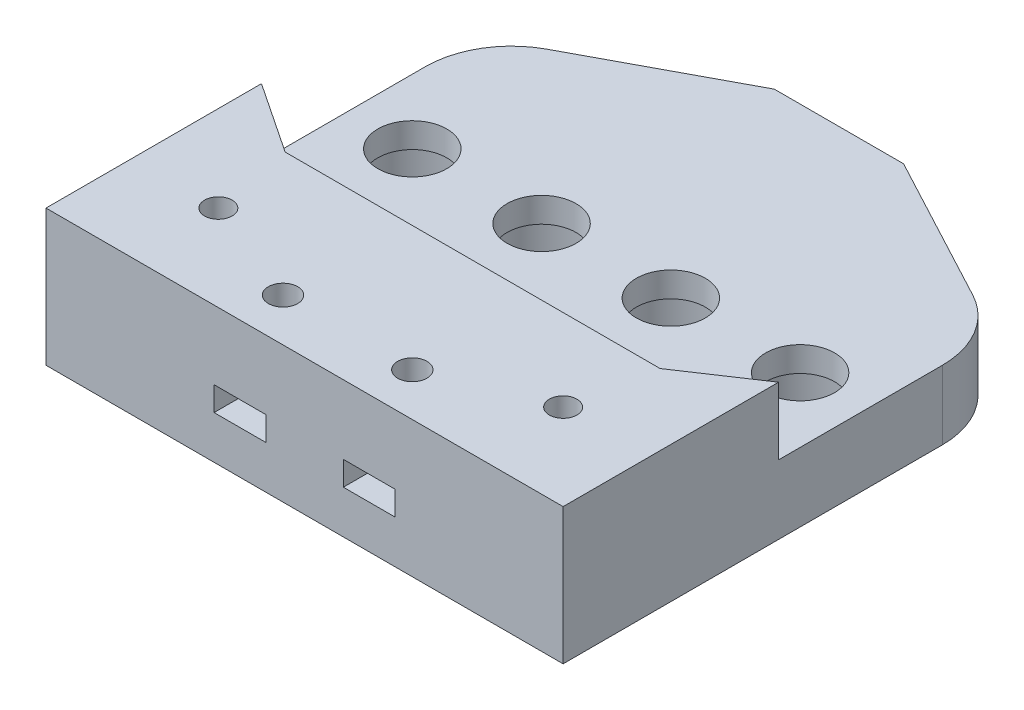
from build123d import *

# Parameters (mm, degrees)
SKETCH2_R           = 4
BOSS_EXTRUDE1_DEPTH = 8
BOSS_EXTRUDE2_DEPTH = 7.8
SKETCH5_R           = 6.55
CUT_EXTRUDE2_DEPTH  = 5.1
FILLET1_R           = 10
SKETCH6_R           = 2.6
CUT_EXTRUDE3_DEPTH  = 6
SKETCH7_W           = 60
SKETCH7_H           = 15.8
BOSS_EXTRUDE3_DEPTH = 15
CUT_EXTRUDE4_REACH  = 79.837
SKETCH8_R           = 1.6
CUT_EXTRUDE5_DEPTH  = 5
SKETCH10_R          = 1.7
CUT_EXTRUDE6_DEPTH  = 78.837266139
CUT_EXTRUDE7_START  = -5
SKETCH11_R          = 1.7
CUT_EXTRUDE7_DEPTH  = 2.8


with BuildPart() as part:
    # Sketch2 → Boss-Extrude1 (new body)
    with BuildSketch(Plane(origin=(0, 0, 0), x_dir=(1, 0, 0), z_dir=(0, 1, 0))):
        Polygon((0, 0), (0, 35), (22.5, 47), (37.5, 47), (60, 35), (60, 0), align=None)
        with Locations((7.5, 20)):
            Circle(SKETCH2_R, mode=Mode.SUBTRACT)
        with Locations((22.5, 20)):
            Circle(SKETCH2_R, mode=Mode.SUBTRACT)
        with Locations((37.5, 20)):
            Circle(SKETCH2_R, mode=Mode.SUBTRACT)
        with Locations((52.5, 20)):
            Circle(SKETCH2_R, mode=Mode.SUBTRACT)
    extrude(amount=BOSS_EXTRUDE1_DEPTH)

    # Sketch3 → Boss-Extrude2 (add)
    with BuildSketch(Plane(origin=(0, 8, 0), x_dir=(1, 0, 0), z_dir=(0, 1, 0))):
        Polygon((0, 10), (0, 0), (60, 0), (60, 10), (51.75, 4.5), (8.25, 4.5), align=None)
    extrude(amount=BOSS_EXTRUDE2_DEPTH)

    # Sketch5 → Cut-Extrude2 (cut)
    with BuildSketch(Plane(origin=(0, 0, 0), x_dir=(1, 0, 0), z_dir=(0, 1, 0))):
        with Locations((7.5, 20)):
            Circle(SKETCH5_R)
        with Locations((22.5, 20)):
            Circle(SKETCH5_R)
        with Locations((37.5, 20)):
            Circle(SKETCH5_R)
        with Locations((52.5, 20)):
            Circle(SKETCH5_R)
    extrude(amount=CUT_EXTRUDE2_DEPTH, mode=Mode.SUBTRACT)

    # Fillet1
    fillet1_edges = [part.edges().sort_by_distance(p)[0] for p in [
        (0, 4, -35),
        (60, 4, -35),
    ]]
    fillet(fillet1_edges, radius=FILLET1_R)

    # Sketch6 → Cut-Extrude3 (cut)
    with BuildSketch(Plane(origin=(0, 0, 0), x_dir=(-1, 0, 0), z_dir=(0, -1, 0))):
        with Locations((-25, 42.25)):
            Circle(SKETCH6_R)
        with Locations((-35, 42.25)):
            Circle(SKETCH6_R)
        with Locations((-35, 4.25)):
            Circle(SKETCH6_R)
        with Locations((-25, 4.25)):
            Circle(SKETCH6_R)
    extrude(amount=-CUT_EXTRUDE3_DEPTH, mode=Mode.SUBTRACT)

    # Sketch7 → Boss-Extrude3 (add)
    with BuildSketch(Plane.XY):
        with Locations((30, 7.9)):
            Rectangle(SKETCH7_W, SKETCH7_H)
    extrude(amount=BOSS_EXTRUDE3_DEPTH)

    # Sketch8 → Cut-Extrude4 (cut, up to next)
    with BuildSketch(Plane(origin=(0, 0, 0), x_dir=(-1, 0, 0), z_dir=(0, -1, 0)), mode=Mode.PRIVATE) as cut_extrude4_sk1:
        with Locations((-10, -5)):
            Circle(SKETCH8_R)
    cut_extrude4_tool1 = extrude(cut_extrude4_sk1.sketch, amount=-CUT_EXTRUDE4_REACH, mode=Mode.PRIVATE) & part.part
    # Sketch8 → Cut-Extrude4 (cut, up to next)
    with BuildSketch(Plane(origin=(0, 0, 0), x_dir=(-1, 0, 0), z_dir=(0, -1, 0)), mode=Mode.PRIVATE) as cut_extrude4_sk2:
        with Locations((-50, -5)):
            Circle(SKETCH8_R)
    cut_extrude4_tool2 = extrude(cut_extrude4_sk2.sketch, amount=-CUT_EXTRUDE4_REACH, mode=Mode.PRIVATE) & part.part
    add(cut_extrude4_tool1.solids().sort_by_distance((10, 0, 5))[0], mode=Mode.SUBTRACT)
    add(cut_extrude4_tool2.solids().sort_by_distance((50, 0, 5))[0], mode=Mode.SUBTRACT)

    # Sketch9 → Cut-Extrude5 (cut)
    with BuildSketch(Plane(origin=(0, 0, 0), x_dir=(-1, 0, 0), z_dir=(0, -1, 0))):
        Polygon((-51.732050808, -2), (-53.464101615, -5), (-51.732050808, -8), (-48.267949192, -8), (-46.535898385, -5), (-48.267949192, -2), align=None)
        Polygon((-13.464101615, -5), (-11.732050808, -8), (-8.267949192, -8), (-6.535898385, -5), (-8.267949192, -2), (-11.732050808, -2), align=None)
    extrude(amount=-CUT_EXTRUDE5_DEPTH, mode=Mode.SUBTRACT)

    # Sketch10 → Cut-Extrude6 (cut, through all)
    with BuildSketch(Plane(origin=(0, 0, 0), x_dir=(-1, 0, 0), z_dir=(0, -1, 0))):
        with Locations((-22.5, -10)):
            Circle(SKETCH10_R)
        with Locations((-37.5, -10)):
            Circle(SKETCH10_R)
    extrude(amount=-CUT_EXTRUDE6_DEPTH, mode=Mode.SUBTRACT)

    # Sketch11 → Cut-Extrude7 (cut)
    # profile 1 of 2: a face of its own
    with BuildSketch(Plane(origin=(0, 0, 0), x_dir=(-1, 0, 0), z_dir=(0, -1, 0)).offset(CUT_EXTRUDE7_START)):
        Polygon((-19.5, -15), (-19.5, -8.267949192), (-22.5, -6.535898385), (-25.5, -8.267949192), (-25.5, -15), align=None)
        with Locations((-22.5, -10)):
            Circle(SKETCH11_R, mode=Mode.SUBTRACT)
    # profile 2 of 2: a face of its own
    with BuildSketch(Plane(origin=(0, 0, 0), x_dir=(-1, 0, 0), z_dir=(0, -1, 0)).offset(CUT_EXTRUDE7_START)):
        Polygon((-40.5, -15), (-34.5, -15), (-34.5, -8.267949192), (-37.5, -6.535898385), (-40.5, -8.267949192), align=None)
        with Locations((-37.5, -10)):
            Circle(SKETCH11_R, mode=Mode.SUBTRACT)
    extrude(amount=-CUT_EXTRUDE7_DEPTH, mode=Mode.SUBTRACT)


solid = part.part
